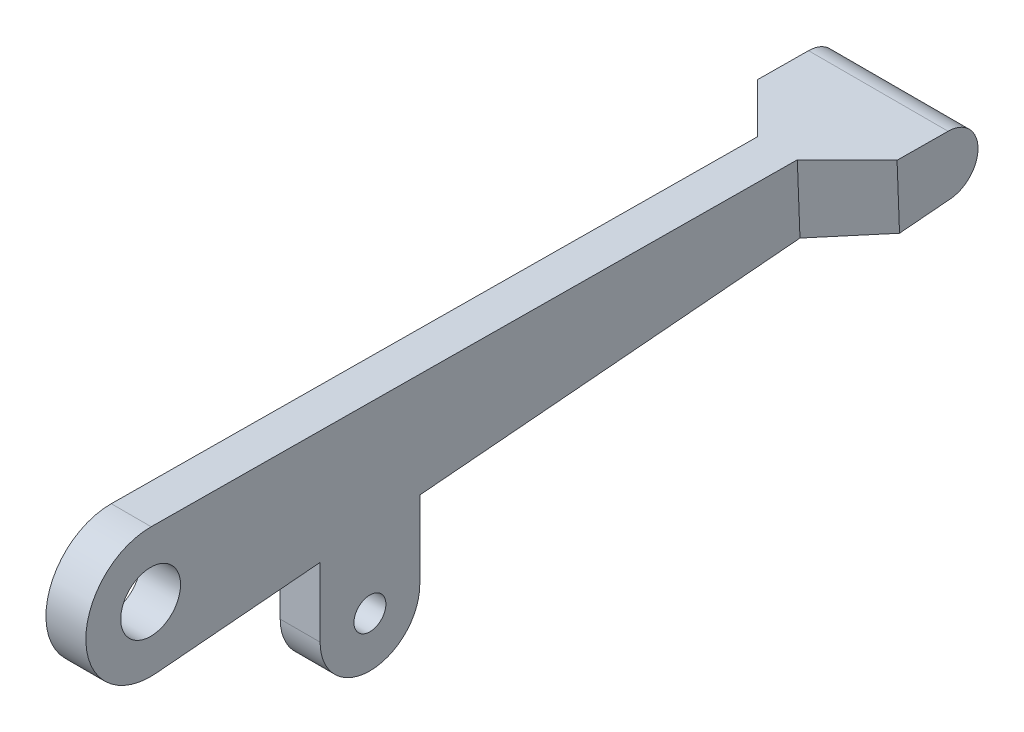
from build123d import *

# Parameters (mm, degrees)
SKETCH1_R                = 1.6
SKETCH1_R_2              = 3
BOSS_EXTRUDE1_DEPTH      = 4
BOSS_EXTRUDE2_DEPTH      = 5
BOSS_EXTRUDE2_DEPTH_BACK = 9
CHAMFER1_SIZE            = 5


with BuildPart() as part:
    # Sketch1 → Boss-Extrude1 (new body)
    with BuildSketch(Plane(origin=(0, 0, 0), x_dir=(0, 0, -1), z_dir=(1, 0, 0))):
        with BuildLine():
            Line((0.053412883, 6.49978054), (75, 5.883896162))
            ThreePointArc((75, 5.883896162), (77.997285796, 3.011480877), (75.25493857, -0.105251932))
            Line((75.25493857, -0.105251932), (27, -4.220820858))
            Line((27, -4.220820858), (27, -12))
            ThreePointArc((27, -12), (22, -17), (17, -12))
            Line((17, -12), (17, -5.073701216))
            Line((17, -5.073701216), (0.552366901, -6.476487536))
            ThreePointArc((0.552366901, -6.476487536), (-6.495200196, -0.249748712), (0.053412883, 6.49978054))
        make_face()
        with Locations((22, -12)):
            Circle(SKETCH1_R, mode=Mode.SUBTRACT)
        Circle(SKETCH1_R_2, mode=Mode.SUBTRACT)
    extrude(amount=BOSS_EXTRUDE1_DEPTH)

    # Sketch2 → Boss-Extrude2 (add, two sides: drawn at the far end of the back side and taken through both)
    with BuildSketch(Plane(origin=(4, 0, 0), x_dir=(0, 0, -1), z_dir=(1, 0, 0)).offset(-BOSS_EXTRUDE2_DEPTH_BACK)):
        with BuildLine():
            Line((70.003692287, 2.691778393), (70.128057116, -0.54251358))
            Line((70.128057116, -0.54251358), (75.25493857, -0.105251932))
            ThreePointArc((75.25493857, -0.105251932), (77.997285796, 3.011480877), (75, 5.883896162))
            Line((75, 5.883896162), (69.879331086, 5.925975997))
            Line((69.879331086, 5.925975997), (70.003692287, 2.691778393))
        make_face()
    extrude(amount=BOSS_EXTRUDE2_DEPTH + BOSS_EXTRUDE2_DEPTH_BACK)

    # Chamfer1
    chamfer1_edges = [part.edges().sort_by_distance(p)[0] for p in [
        (0, 2.691731208, -70.003694101),
        (4, 2.691731208, -70.003694101),
    ]]
    chamfer(chamfer1_edges, length=CHAMFER1_SIZE - 0.0001)  # a hair under: the kernel refuses the full size


solid = part.part
